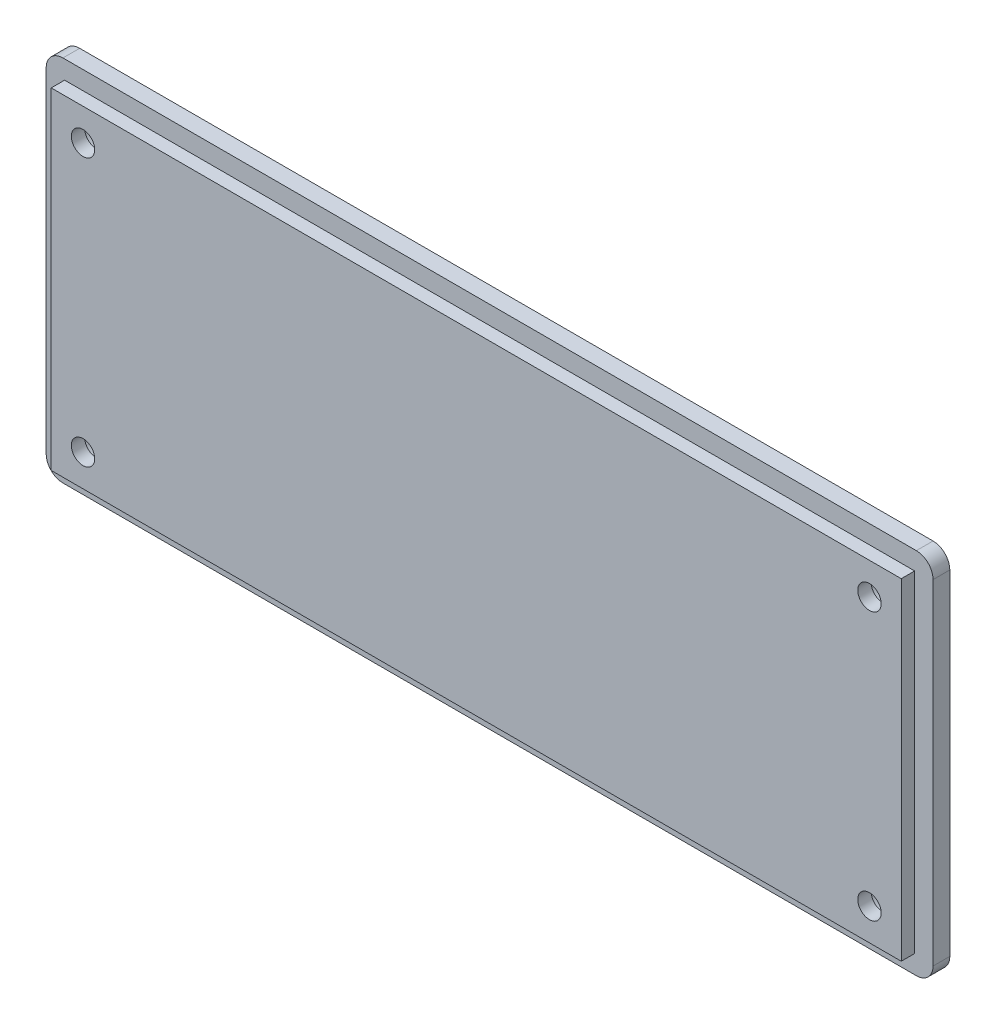
from build123d import *

# Parameters (mm, degrees)
SKETCH_1_W                     = 106
SKETCH_1_H                     = 44
BODY_DEPTH                     = 2
SKETCH_2_W                     = 101.6
SKETCH_2_H                     = 39.6
INTERNALBODY_DEPTH             = 1.6
SKETCH_3_R                     = 1.4
HOLESCREW_DEPTH                = 58.497478206
SKETCH_3_3_R                   = 2.5
SKETCH_3_3_R_2                 = 1.4
TOPSCREWPLACE_DEPTH            = 2
SCREWMIRROR2_COPY_1_SKETCH_R   = 1.4
SCREWMIRROR2_COPY_1_DEPTH      = 58.497478206
SCREWMIRROR2_COPY_2_SKETCH_R   = 2.5
SCREWMIRROR2_COPY_2_SKETCH_R_2 = 1.4
SCREWMIRROR2_COPY_2_DEPTH      = 2
SCREWMIRROR2_COPY_3_SKETCH_R   = 1.4
SCREWMIRROR2_COPY_3_DEPTH      = 58.497478206
CORNERS_R                      = 2


with BuildPart() as part:
    # Эскиз1 → Body (new body)
    with BuildSketch(Plane.XY):
        Rectangle(SKETCH_1_W, SKETCH_1_H)
    extrude(amount=BODY_DEPTH)

    # Эскиз2 → InternalBody (add)
    with BuildSketch(Plane.XY.offset(2)):
        Rectangle(SKETCH_2_W, SKETCH_2_H)
    extrude(amount=INTERNALBODY_DEPTH)

    # Эскиз3 → HoleScrew (cut, through all)
    with BuildSketch(Plane(origin=(0, 0, 0), x_dir=(-1, 0, 0), z_dir=(0, 0, -1))):
        with Locations((47, -16)):
            Circle(SKETCH_3_R)
    holescrew = extrude(amount=-HOLESCREW_DEPTH, mode=Mode.SUBTRACT)

    # Эскиз3<3> → TopScrewPlace (cut)
    with BuildSketch(Plane(origin=(0, 0, 0), x_dir=(-1, 0, 0), z_dir=(0, 0, -1))):
        with Locations((47, -16)):
            Circle(SKETCH_3_3_R)
        with Locations((47, -16)):
            Circle(SKETCH_3_3_R_2, mode=Mode.SUBTRACT)
    topscrewplace = extrude(amount=-TOPSCREWPLACE_DEPTH, mode=Mode.SUBTRACT)

    # ScrewMrror1: HoleScrew, TopScrewPlace across plane
    add(holescrew.mirror(Plane.ZX), mode=Mode.SUBTRACT)
    add(topscrewplace.mirror(Plane.ZX), mode=Mode.SUBTRACT)

    # ScrewMirror2: TopScrewPlace across plane
    add(topscrewplace.mirror(Plane(origin=(0, 0, 0), x_dir=(0, 0, 1), z_dir=(1, 0, 0))), mode=Mode.SUBTRACT)

    # ScrewMirror2 copy 1 sketch → ScrewMirror2 copy 1 (cut, through all)
    with BuildSketch(Plane(origin=(0, 0, 0), x_dir=(1, 0, 0), z_dir=(0, 0, -1))):
        with Locations((47, -16)):
            Circle(SCREWMIRROR2_COPY_1_SKETCH_R)
    extrude(amount=-SCREWMIRROR2_COPY_1_DEPTH, mode=Mode.SUBTRACT)

    # ScrewMirror2 copy 2 sketch → ScrewMirror2 copy 2 (cut)
    with BuildSketch(Plane(origin=(0, 0, 0), x_dir=(1, 0, 0), z_dir=(0, 0, -1))):
        with Locations((47, -16)):
            Circle(SCREWMIRROR2_COPY_2_SKETCH_R)
        with Locations((47, -16)):
            Circle(SCREWMIRROR2_COPY_2_SKETCH_R_2, mode=Mode.SUBTRACT)
    extrude(amount=-SCREWMIRROR2_COPY_2_DEPTH, mode=Mode.SUBTRACT)

    # ScrewMirror2 copy 3 sketch → ScrewMirror2 copy 3 (cut, through all)
    with BuildSketch(Plane(origin=(0, 0, 0), x_dir=(1, 0, 0), z_dir=(0, 0, -1))):
        with Locations((47, 16)):
            Circle(SCREWMIRROR2_COPY_3_SKETCH_R)
    extrude(amount=-SCREWMIRROR2_COPY_3_DEPTH, mode=Mode.SUBTRACT)

    # Corners
    corners_edges = [part.edges().sort_by_distance(p)[0] for p in [
        (-53, -22, 1),
        (53, -22, 1),
        (53, 22, 1),
        (-53, 22, 1),
    ]]
    fillet(corners_edges, radius=CORNERS_R)


solid = part.part
